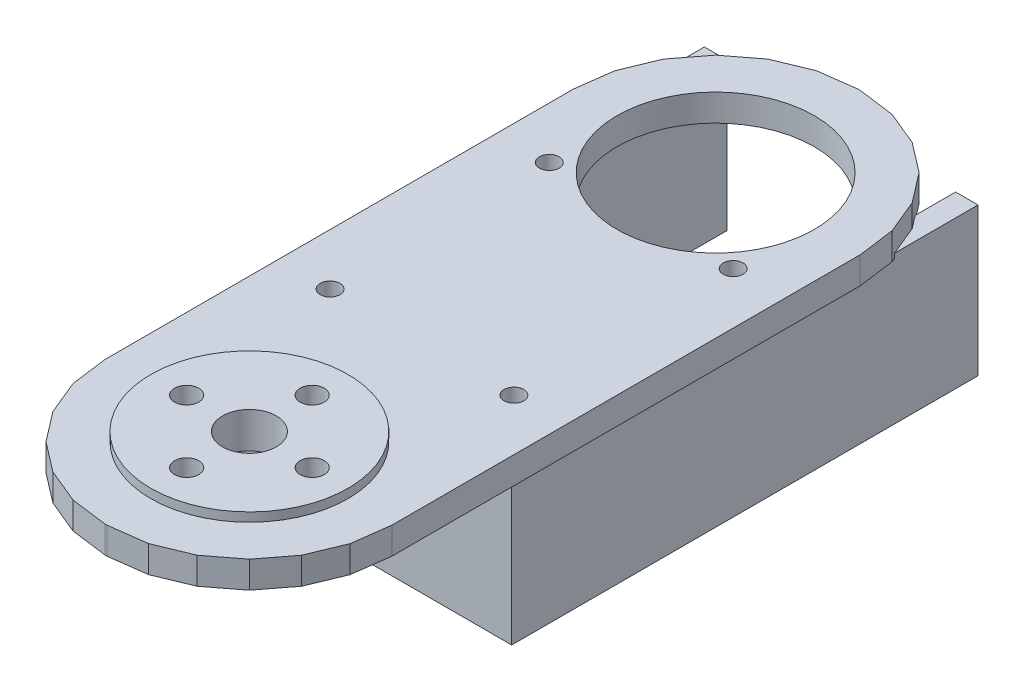
from build123d import *

# Parameters (mm, degrees)
S_CYL1_R      = 11
BOSS_1_DEPTH  = 1.1
BOSS_2_DEPTH  = 3
S_BOX3_W      = 2.5
S_BOX3_H      = 16.5
BOSS_3_DEPTH  = 52.01
S_BOX4_W      = 2.5
S_BOX4_H      = 16.5
BOSS_4_DEPTH  = 52.01
S_BOX5_W      = 30.52
S_BOX5_H      = 16.5
BOSS_5_DEPTH  = 2.5
S_HOLE6_R     = 3
HOLE_6_DEPTH  = 4.2
S_HOLE7_R     = 1.35
HOLE_7_DEPTH  = 4.2
S_HOLE8_R     = 1.35
HOLE_8_DEPTH  = 4.2
S_HOLE9_R     = 1.35
HOLE_9_DEPTH  = 4.2
S_HOLE10_R    = 1.35
HOLE_10_DEPTH = 4.2
S_HOLE11_R    = 11
HOLE_11_DEPTH = 3.2
S_HOLE12_R    = 1.1
HOLE_12_DEPTH = 3.2
S_HOLE13_R    = 1.1
HOLE_13_DEPTH = 3.2
S_HOLE14_R    = 1.1
HOLE_14_DEPTH = 3.2
S_HOLE15_R    = 1.1
HOLE_15_DEPTH = 3.2


with BuildPart() as part:
    # S_cyl1 → Boss_1 (new body)
    with BuildSketch(Plane(origin=(0, -1.1, 0), x_dir=(1, 0, 0), z_dir=(0, 1, 0))):
        Circle(S_CYL1_R)
    extrude(amount=BOSS_1_DEPTH)

    # S_prism2 → Boss_2 (add)
    with BuildSketch(Plane(origin=(0, -4, 0), x_dir=(1, 0, 0), z_dir=(0, 1, 0))):
        Polygon((-16, -0.1), (-15.458, -4.215), (-13.87, -8.05), (-11.343, -11.343), (-8.05, -13.87), (-4.215, -15.458), (-0.1, -16), (0.1, -16), (4.215, -15.458), (8.05, -13.87), (11.343, -11.343), (13.87, -8.05), (15.458, -4.215), (16, -0.1), (16, 52.1), (15.458, 56.215), (13.87, 60.05), (11.343, 63.343), (8.05, 65.87), (4.215, 67.458), (0.1, 68), (-0.1, 68), (-4.215, 67.458), (-8.05, 65.87), (-11.343, 63.343), (-13.87, 60.05), (-15.458, 56.215), (-16, 52.1), align=None)
    extrude(amount=BOSS_2_DEPTH)

    # S_box3 → Boss_3 (add)
    with BuildSketch(Plane.XY.offset(-66)):
        with Locations((14.01, -11.75)):
            Rectangle(S_BOX3_W, S_BOX3_H)
    extrude(amount=BOSS_3_DEPTH)

    # S_box4 → Boss_4 (add)
    with BuildSketch(Plane.XY.offset(-66)):
        with Locations((-14.01, -11.75)):
            Rectangle(S_BOX4_W, S_BOX4_H)
    extrude(amount=BOSS_4_DEPTH)

    # S_box5 → Boss_5 (add)
    with BuildSketch(Plane.XY.offset(-16.49)):
        with Locations((0, -11.75)):
            Rectangle(S_BOX5_W, S_BOX5_H)
    extrude(amount=BOSS_5_DEPTH)

    # S_hole6 → Hole_6 (cut)
    with BuildSketch(Plane(origin=(0, -4.1, 0), x_dir=(1, 0, 0), z_dir=(0, 1, 0))):
        Circle(S_HOLE6_R)
    extrude(amount=HOLE_6_DEPTH, mode=Mode.SUBTRACT)

    # S_hole7 → Hole_7 (cut)
    with BuildSketch(Plane(origin=(0, -4.1, 0), x_dir=(1, 0, 0), z_dir=(0, 1, 0))):
        with Locations((7, 0)):
            Circle(S_HOLE7_R)
    extrude(amount=HOLE_7_DEPTH, mode=Mode.SUBTRACT)

    # S_hole8 → Hole_8 (cut)
    with BuildSketch(Plane(origin=(0, -4.1, 0), x_dir=(1, 0, 0), z_dir=(0, 1, 0))):
        with Locations((0, -7)):
            Circle(S_HOLE8_R)
    extrude(amount=HOLE_8_DEPTH, mode=Mode.SUBTRACT)

    # S_hole9 → Hole_9 (cut)
    with BuildSketch(Plane(origin=(0, -4.1, 0), x_dir=(1, 0, 0), z_dir=(0, 1, 0))):
        with Locations((-7, 0)):
            Circle(S_HOLE9_R)
    extrude(amount=HOLE_9_DEPTH, mode=Mode.SUBTRACT)

    # S_hole10 → Hole_10 (cut)
    with BuildSketch(Plane(origin=(0, -4.1, 0), x_dir=(1, 0, 0), z_dir=(0, 1, 0))):
        with Locations((0, 7)):
            Circle(S_HOLE10_R)
    extrude(amount=HOLE_10_DEPTH, mode=Mode.SUBTRACT)

    # S_hole11 → Hole_11 (cut)
    with BuildSketch(Plane(origin=(0, -4.1, 0), x_dir=(1, 0, 0), z_dir=(0, 1, 0))):
        with Locations((0, 52)):
            Circle(S_HOLE11_R)
    extrude(amount=HOLE_11_DEPTH, mode=Mode.SUBTRACT)

    # S_hole12 → Hole_12 (cut)
    with BuildSketch(Plane(origin=(0, -4.1, 0), x_dir=(1, 0, 0), z_dir=(0, 1, 0))):
        with Locations((-10.25, 43.7)):
            Circle(S_HOLE12_R)
    extrude(amount=HOLE_12_DEPTH, mode=Mode.SUBTRACT)

    # S_hole13 → Hole_13 (cut)
    with BuildSketch(Plane(origin=(0, -4.1, 0), x_dir=(1, 0, 0), z_dir=(0, 1, 0))):
        with Locations((10.25, 43.7)):
            Circle(S_HOLE13_R)
    extrude(amount=HOLE_13_DEPTH, mode=Mode.SUBTRACT)

    # S_hole14 → Hole_14 (cut)
    with BuildSketch(Plane(origin=(0, -4.1, 0), x_dir=(1, 0, 0), z_dir=(0, 1, 0))):
        with Locations((-10.25, 19.25)):
            Circle(S_HOLE14_R)
    extrude(amount=HOLE_14_DEPTH, mode=Mode.SUBTRACT)

    # S_hole15 → Hole_15 (cut)
    with BuildSketch(Plane(origin=(0, -4.1, 0), x_dir=(1, 0, 0), z_dir=(0, 1, 0))):
        with Locations((10.25, 19.25)):
            Circle(S_HOLE15_R)
    extrude(amount=HOLE_15_DEPTH, mode=Mode.SUBTRACT)


solid = part.part
